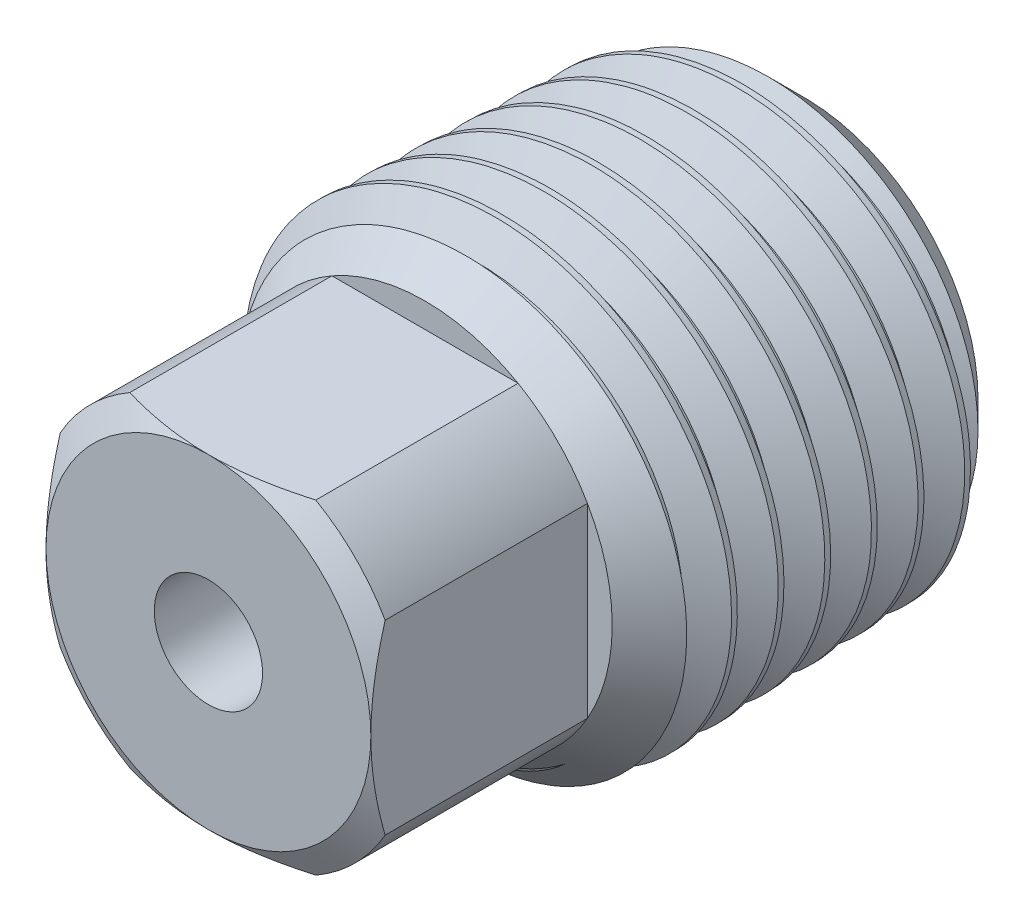
from build123d import *
from OCP.BRepFilletAPI import BRepFilletAPI_MakeChamfer

# Parameters (mm, degrees)
SKETCH2_R              = 6.858
EXTRUDE1_DEPTH         = 11.1125
EXTRUDE1_DRAFT         = -1.783333333
CHAMFER1_SIZE          = 1.411111111
CHAMFER1_SIZE2         = 1.369165802
CHAMFER1_SIZE2_2       = 1.457163839
CUT_SWEEP1_PITCH       = 1.411794907
CUT_SWEEP1_HEIGHT      = 12.523611111
CUT_SWEEP1_RADIUS      = 6.512011277
CUT_SWEEP1_START_ANGLE = 90
EXTRUDE2_DEPTH         = 6.35
SKETCH6_OUTSIDE_W      = 93.332
SKETCH6_OUTSIDE_H      = 93.31
SKETCH6_OUTSIDE_R      = 4.7625
EXTRUDE3_DEPTH         = 20.939585897
EXTRUDE3_DRAFT         = -60
SKETCH7_R              = 1.5875
CUT_EXTRUDE1_DEPTH     = 20.939585897


with BuildPart() as part:
    # Sketch2 → Extrude1 (with draft: the straight prism first)
    with BuildSketch(Plane.XY):
        Circle(SKETCH2_R)
    extrude(amount=-EXTRUDE1_DEPTH)
    # Extrude1: the draft: its side faces are tilted about the plane it starts from
    extrude1_sides = [part.faces().sort_by_distance(p)[0] for p in [
        (-6.858, 0, -5.55625),
    ]]
    draft(extrude1_sides, Plane.XY, EXTRUDE1_DRAFT)

    # Chamfer1: one chamfer whose edges measure the first distance from different faces: ONE call of the kernel's chamfer builder (chamfer() names one face for all edges)
    chamfer1_edges_1 = [part.edges().sort_by_distance(p)[0] for p in [
        (-6.858, 0, 0),
    ]]
    chamfer1_side_1 = [part.faces().sort_by_distance(p)[0] for p in [
        (-6.685005638, 0, -5.55625),
    ]]
    chamfer1_edges_2 = [part.edges().sort_by_distance(p)[0] for p in [
        (-6.512011277, 0, -11.1125),
    ]]
    chamfer1_side_2 = [part.faces().sort_by_distance(p)[0] for p in [
        (0, 0, -11.1125),
    ]]
    chamfer1 = BRepFilletAPI_MakeChamfer(part.part.solid().wrapped)
    for e in chamfer1_edges_1:
        chamfer1.Add(CHAMFER1_SIZE, CHAMFER1_SIZE2, e.wrapped, chamfer1_side_1[0].wrapped)  # the first distance lies on this face
    for e in chamfer1_edges_2:
        chamfer1.Add(CHAMFER1_SIZE, CHAMFER1_SIZE2_2, e.wrapped, chamfer1_side_2[0].wrapped)  # the first distance lies on this face
    add(Compound.cast(chamfer1.Shape()), mode=Mode.REPLACE)

    # Cut-Sweep1: sweep along a helix
    with BuildLine() as cut_sweep1_path:
        # a taper helix: rise per turn along the axis 1.411111111, along the cone's slant (build123d's pitch) 1.411794907
        add(Helix(CUT_SWEEP1_PITCH, CUT_SWEEP1_HEIGHT, CUT_SWEEP1_RADIUS, center=(0, 0, -11.1125), direction=(0, 0, 1), cone_angle=1.783333333, mode=Mode.PRIVATE).rotate(Axis((0, 0, -11.1125), (0, 0, 1)), CUT_SWEEP1_START_ANGLE))
    # Sketch4 → Cut-Sweep1 (sweep, cut)
    with BuildSketch(Plane(origin=(0, 0, 0), x_dir=(0, 0, -1), z_dir=(1, 0, 0))):
        Polygon((10.406944444, 6.664768535), (11.729861111, 6.512011277), (11.200694444, 5.595467724), (11.024305556, 5.595467724), align=None)
    sweep(path=cut_sweep1_path.line, is_frenet=True, mode=Mode.SUBTRACT)

    # Extrude2: read off the stored shape, not the designer's step
    # Extrude2 outline → Extrude2 (add)
    with BuildSketch(Plane.XY):
        with BuildLine():
            ThreePointArc((2.728716659, -4.7625), (3.881191882, -3.881191882), (4.7625, -2.728716659))
            Line((4.7625, -2.728716659), (4.7625, 2.728716659))
            ThreePointArc((4.7625, 2.728716659), (3.881191882, 3.881191882), (2.728716659, 4.7625))
            Line((2.728716659, 4.7625), (-2.728716659, 4.7625))
            ThreePointArc((-2.728716659, 4.7625), (-3.881191882, 3.881191882), (-4.7625, 2.728716659))
            Line((-4.7625, 2.728716659), (-4.7625, -2.728716659))
            ThreePointArc((-4.7625, -2.728716659), (-3.881191882, -3.881191882), (-2.728716659, -4.7625))
            Line((-2.728716659, -4.7625), (2.728716659, -4.7625))
        make_face()
    extrude(amount=EXTRUDE2_DEPTH)


with BuildPart() as extrude3_tool:
    # Sketch6 outside → Extrude3 (with draft: the straight prism first)
    with BuildSketch(Plane.XY.offset(6.35)):
        with Locations((-0.011, 0.011)):
            Rectangle(SKETCH6_OUTSIDE_W, SKETCH6_OUTSIDE_H)
        Circle(SKETCH6_OUTSIDE_R, mode=Mode.SUBTRACT)
    extrude(amount=-EXTRUDE3_DEPTH)
    # Extrude3: the draft: its side faces are tilted about the plane it starts from
    extrude3_sides = [extrude3_tool.faces().sort_by_distance(p)[0] for p in [
        (-0.011, -46.644, -4.119792949),
        (46.655, 0.011, -4.119792949),
        (-0.011, 46.666, -4.119792949),
        (-46.677, 0.011, -4.119792949),
        (-4.7625, 0, -4.119792949),
    ]]
    draft(extrude3_sides, Plane.XY.offset(6.35), EXTRUDE3_DRAFT)


with BuildPart() as part_1:
    add(part.part)

    # Extrude3: cut by extrude3_tool
    add(extrude3_tool.part, mode=Mode.SUBTRACT)

    # Sketch7 → Cut-Extrude1 (cut, through all)
    with BuildSketch(Plane.XY.offset(6.35)):
        Circle(SKETCH7_R)
    extrude(amount=-CUT_EXTRUDE1_DEPTH, mode=Mode.SUBTRACT)


solid = part_1.part
